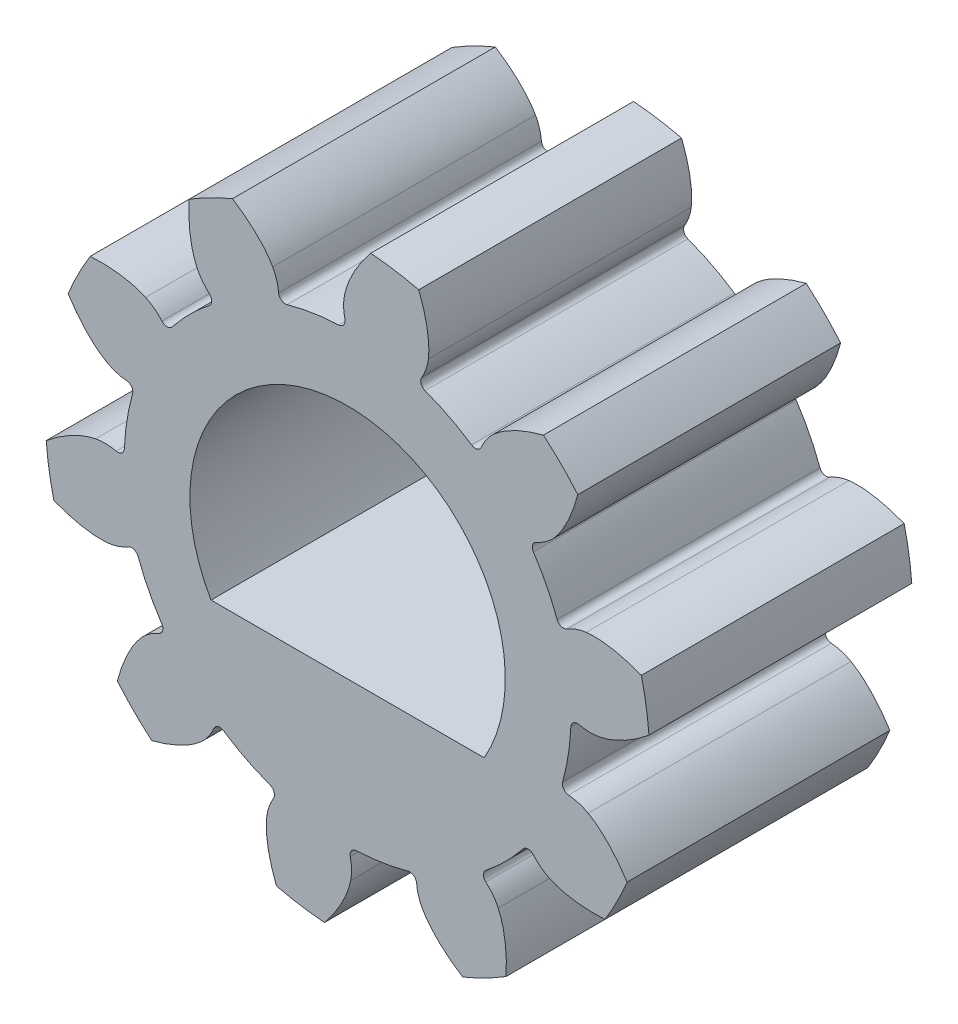
from build123d import *

# Parameters (mm, degrees)
BOSS_EXTRUDE1_DEPTH      = 2.5
BOSS_EXTRUDE1_DEPTH_BACK = 2.5
SKETCH3_R                = 4.250000136
SKETCH3_R_2              = 3.250000104
BOSS_EXTRUDE2_DEPTH      = 2.499999953
FILLET1_START            = -2.499999953
FILLET1_DEPTH            = 4.999999906
CIRPATTERN2_COUNT        = 10
SKETCH5_R                = 3.75000012
BOSS_EXTRUDE3_DEPTH      = 2.499999953


with BuildPart() as part:
    # Sketch3 → Boss-Extrude1 (new, two sides: drawn at the far end of the back side and taken through both)
    with BuildSketch(Plane.XY.offset(-BOSS_EXTRUDE1_DEPTH_BACK)):
        Circle(SKETCH3_R)
        Circle(SKETCH3_R_2, mode=Mode.SUBTRACT)
    extrude(amount=BOSS_EXTRUDE1_DEPTH + BOSS_EXTRUDE1_DEPTH_BACK)

    # Sketch4 → Boss-Extrude2 (add, symmetric)
    with BuildSketch(Plane.XY):
        with BuildLine():
            ThreePointArc((0.059475878, -4.792798206), (0.070704258, -4.517182324), (0.002121558, -4.249999606))
            Line((0.002121558, -4.249999606), (-1.315339826, -4.041334222))
            ThreePointArc((-1.315339826, -4.041334222), (-1.46312985, -4.274246867), (-1.537621018, -4.539842908))
            add(Edge.make_bspline(
                [(-1.353420393, -5.588448385), (-1.36033392, -5.571041164), (-1.422869334, -5.40962181), (-1.525615911, -5.065419058), (-1.557719578, -4.724391009), (-1.537621018, -4.539842908)],
                knots=[0.738415305, 0.738415305, 0.738415305, 0.738415305, 0.752094685, 0.864840392, 1, 1, 1, 1], degree=3))
            ThreePointArc((-1.353420393, -5.588448385), (-0.899498203, -5.67920814), (-0.439746239, -5.733160155))
            add(Edge.make_bspline(
                [(-0.439746239, -5.733160155), (-0.427791957, -5.7187413), (-0.318435921, -5.584546878), (-0.114353619, -5.288941046), (0.021562245, -4.974524677), (0.059475878, -4.792798206)],
                knots=[0.738415305, 0.738415305, 0.738415305, 0.738415305, 0.752094685, 0.864840392, 1, 1, 1, 1], degree=3))
        make_face()
    boss_extrude2 = extrude(amount=BOSS_EXTRUDE2_DEPTH, both=True)

    # Fillet1: read off the stored shape, not the designer's step
    # Fillet1 outline → Fillet1 (add)
    with BuildSketch(Plane.XY.offset(FILLET1_START)):
        with BuildLine():
            ThreePointArc((-1.315339826, -4.041334222), (-1.39490789, -4.014565123), (-1.473931687, -3.986229614))
            ThreePointArc((-1.473931687, -3.986229614), (-1.39812366, -4.063343233), (-1.409207576, -4.170909557))
            ThreePointArc((-1.409207576, -4.170909557), (-1.365011999, -4.104138195), (-1.315339826, -4.041334222))
        make_face()
        with BuildLine():
            ThreePointArc((0.051354112, -4.402239803), (0.074052504, -4.296513032), (0.169979641, -4.24659959))
            ThreePointArc((0.169979641, -4.24659959), (0.08606739, -4.249128564), (0.002121558, -4.249999606))
            ThreePointArc((0.002121558, -4.249999606), (0.029955107, -4.325079279), (0.051354112, -4.402239803))
        make_face()
    fillet1 = extrude(amount=FILLET1_DEPTH)

    # CirPattern2: Boss-Extrude2, Fillet1 ×10 about axis
    cirpattern2_axis = Axis((0, 0, -2.499999953), (0, 0, 1))
    add([boss_extrude2.rotate(cirpattern2_axis, i * 360 / CIRPATTERN2_COUNT) for i in range(1, CIRPATTERN2_COUNT)])
    add([fillet1.rotate(cirpattern2_axis, i * 360 / CIRPATTERN2_COUNT) for i in range(1, CIRPATTERN2_COUNT)])

    # Sketch5 → Boss-Extrude3 (add, symmetric)
    # profile 1 of 2: a face of its own
    with BuildSketch(Plane.XY):
        Circle(SKETCH5_R)
        with BuildLine():
            ThreePointArc((2.598076211, -1.5), (0, -3), (-2.598076211, -1.5))
            ThreePointArc((-2.598076211, -1.5), (-0.776457135, 2.897777479), (3, 0))
            ThreePointArc((3, 0), (2.897777479, -0.776457135), (2.598076211, -1.5))
        make_face(mode=Mode.SUBTRACT)
    # profile 2 of 2: a face of its own
    with BuildSketch(Plane.XY):
        with BuildLine():
            Line((2.598076211, -1.5), (-2.598076211, -1.5))
            ThreePointArc((-2.598076211, -1.5), (0, -3), (2.598076211, -1.5))
        make_face()
    extrude(amount=BOSS_EXTRUDE3_DEPTH, both=True)


solid = part.part
